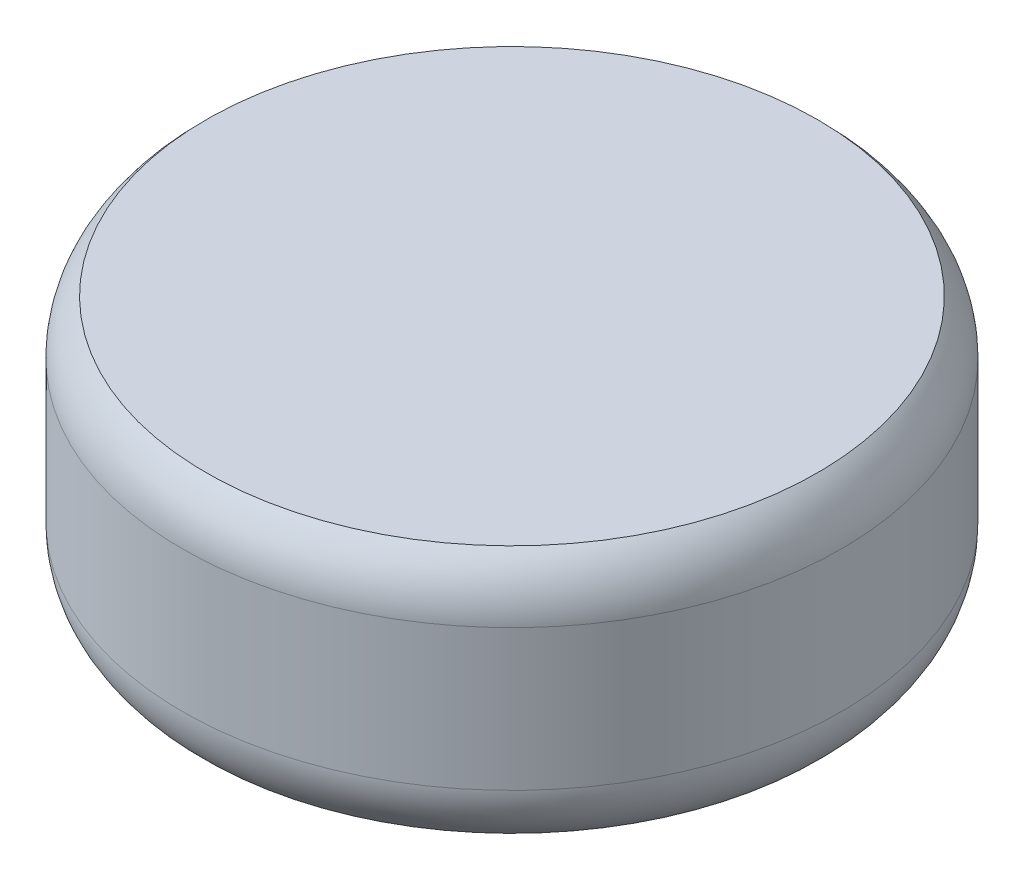
from build123d import *

# Parameters (mm, degrees)
ENL_V_START             = -0.2
ESQUISSE2_R             = 1
ENL_V_MAT_EXTRU_1_DEPTH = 0.4


# Read off the part's stored shape, not the designer's step: Coque1
with BuildPart() as part:
    # Esquisse1 → Révolution1 (revolve)
    with BuildSketch(Plane.XY, mode=Mode.PRIVATE) as r_volution1_sk:
        with BuildLine():
            Line((0, 0), (0, 34))
            Line((0, 34), (41.75, 34))
            ThreePointArc((41.75, 34), (44.151502609, 30.652951592), (45, 26.621822718))
            Line((45, 26.621822718), (45, 7.378177282))
            ThreePointArc((45, 7.378177282), (44.151502609, 3.347048408), (41.75, 0))
            Line((41.75, 0), (0, 0))
        make_face()
    revolve(r_volution1_sk.sketch.rotate(Axis((0, 34, 0), (0, 1, 0)), 90), axis=Axis((0, 34, 0), (0, 1, 0)))

    # Coque1 outline → Coque1 (revolve, cut)
    with BuildSketch(Plane.XY):
        with BuildLine():
            Line((44.6, 7.378177282), (44.6, 26.621822718))
            ThreePointArc((44.6, 26.621822718), (43.973260711, 30.033653928), (42.174876624, 33))
            Line((42.174876624, 33), (0, 33))
            Line((0, 33), (0, 0))
            Line((0, 0), (41.141864538, 0))
            ThreePointArc((41.141864538, 0), (43.692580157, 3.303984083), (44.6, 7.378177282))
        make_face()
    revolve(axis=Axis((0, 0, 0), (0, 1, 0)), mode=Mode.SUBTRACT)

    # Esquisse2 → Enlèv. mat.-Extru.1 (cut)
    with BuildSketch(Plane(origin=(0, 34, 0), x_dir=(1, 0, 0), z_dir=(0, 1, 0)).offset(ENL_V_START)):
        with Locations(Location((-31.5, 0, 0), (0, 0, 270))):
            Circle(ESQUISSE2_R)
        with Locations(Location((31.5, 0, 0), (0, 0, 90))):
            Circle(ESQUISSE2_R)
    extrude(amount=-ENL_V_MAT_EXTRU_1_DEPTH, mode=Mode.SUBTRACT)


solid = part.part
